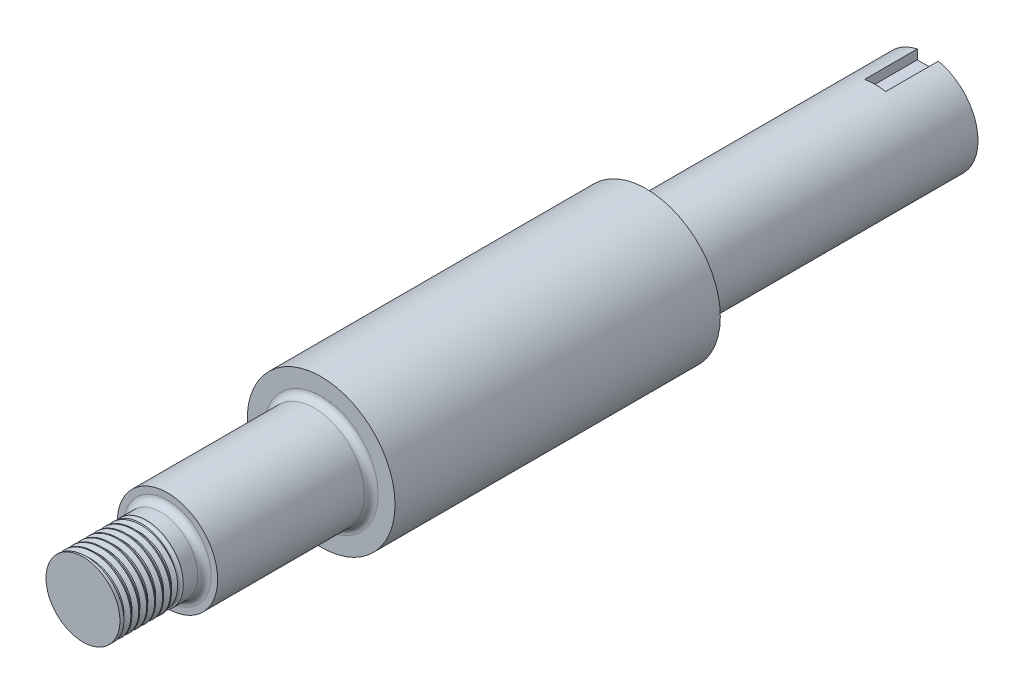
from build123d import *

# Parameters (mm, degrees)
BEARING_REST_FILLET_0_13CM_R = 1.3
CHUCK_THREAD_PITCH           = 1.5
THREAD_SLOT_SKETCH_R         = 0.5
SKETCH_KEY_W                 = 4
SKETCH_KEY_H                 = 2
KEY_CUT_DEPTH                = 10


with BuildPart() as part:
    # Sketch Spindle Skeleton one side → Revolve Spindle (revolve)
    with BuildSketch(Plane(origin=(0, 0, 0), x_dir=(0, 0, -1), z_dir=(1, 0, 0)), mode=Mode.PRIVATE) as revolve_spindle_sk:
        Polygon((-160, 7), (-160, 0), (0, 0), (0, 9.5), (-53.3, 9.5), (-53.3, 14), (-114.9, 14), (-114.9, 9.5), (-144, 9.5), (-144, 7), align=None)
    revolve(revolve_spindle_sk.sketch.rotate(Axis((0, 0, 1000), (0, 0, -1)), 90), axis=Axis((0, 0, 1000), (0, 0, -1)))

    # Bearing Rest Fillet 0.13cm
    bearing_rest_fillet_0_13cm_edges = [part.edges().sort_by_distance(p)[0] for p in [
        (-7, 0, 144),
        (-9.5, 0, 114.9),
        (-9.5, 0, 53.3),
    ]]
    fillet(bearing_rest_fillet_0_13cm_edges, radius=BEARING_REST_FILLET_0_13CM_R)

    # Chuck Thread: the profile of Thread Profile2 profile screwed along a right-hand helix of 6.666667 turns, 8 arcs to a turn; built about Z, then put on its axis
    chuck_thread_z = Axis((0, 0, 0), (0, 0, 1))
    chuck_thread_corners = [(7.0003, 0, -0.000173205), (7.0003, 0, 1.312673201), (6.188101187, 0, 0.843749998), (6.188101187, 0, 0.468749998)]
    with BuildLine(mode=Mode.PRIVATE) as chuck_thread_profile:
        Line(chuck_thread_corners[0], chuck_thread_corners[1])
        Line(chuck_thread_corners[1], chuck_thread_corners[2])
        Line(chuck_thread_corners[2], chuck_thread_corners[3])
        Line(chuck_thread_corners[3], chuck_thread_corners[0])
    chuck_thread_cap = Face(chuck_thread_profile.wire())
    chuck_thread_turn_angles = [0, 22.5, 45, 67.5, 90, 112.5, 135, 157.5, 180, 202.5, 225, 247.5, 270, 292.5, 315, 337.5, 360]
    chuck_thread_turn_weights = [1, 0.9238795325112867, 1, 0.9238795325112867, 1, 0.9238795325112867, 1, 0.9238795325112867, 1, 0.9238795325112867, 1, 0.9238795325112867, 1, 0.9238795325112867, 1, 0.9238795325112867, 1]
    chuck_thread_turn_rails = [Edge.make_bspline([Vector(p[0], p[1], 0).rotate(chuck_thread_z, chuck_thread_turn_angles[k]) / chuck_thread_turn_weights[k] + Vector(0, 0, p[2] + CHUCK_THREAD_PITCH * chuck_thread_turn_angles[k] / 360) for k in range(17)], [0, 0, 0, 1, 1, 2, 2, 3, 3, 4, 4, 5, 5, 6, 6, 7, 7, 8, 8, 8], 2, chuck_thread_turn_weights) for p in chuck_thread_corners]
    chuck_thread_turn_sides = [Face.make_surface_from_curves(chuck_thread_turn_rails[p[0]], chuck_thread_turn_rails[p[1]]) for p in [(0, 1), (1, 2), (2, 3), (3, 0)]]
    chuck_thread_last_angles = [2160, 2182.5, 2205, 2227.5, 2250, 2272.5, 2295, 2317.5, 2340, 2362.5, 2385, 2392.5, 2400]
    chuck_thread_last_weights = [1, 0.9238795325112867, 1, 0.9238795325112867, 1, 0.9238795325112867, 1, 0.9238795325112867, 1, 0.9238795325112867, 1, 0.9914448613738109, 1]
    chuck_thread_last_rails = [Edge.make_bspline([Vector(p[0], p[1], 0).rotate(chuck_thread_z, chuck_thread_last_angles[k]) / chuck_thread_last_weights[k] + Vector(0, 0, p[2] + CHUCK_THREAD_PITCH * chuck_thread_last_angles[k] / 360) for k in range(13)], [0, 0, 0, 1, 1, 2, 2, 3, 3, 4, 4, 5, 5, 6, 6, 6], 2, chuck_thread_last_weights) for p in chuck_thread_corners]
    chuck_thread_last_sides = [Face.make_surface_from_curves(chuck_thread_last_rails[p[0]], chuck_thread_last_rails[p[1]]) for p in [(0, 1), (1, 2), (2, 3), (3, 0)]]
    chuck_thread = Plane(origin=(0, 0, 160), x_dir=(-1, 0, 0), z_dir=(0, 0, -1)) * Solid(Shell([*[p.moved(Location((0, 0, CHUCK_THREAD_PITCH * i))) for i in range(6) for p in chuck_thread_turn_sides], *chuck_thread_last_sides, chuck_thread_cap, chuck_thread_cap.rotate(chuck_thread_z, 2400).moved(Location((0, 0, CHUCK_THREAD_PITCH * 2400 / 360)))]))
    add(chuck_thread, mode=Mode.SUBTRACT)

    # Thread Slot Sketch → Thread Slot (revolve, cut)
    with BuildSketch(Plane(origin=(0, 0, 0), x_dir=(0, 0, -1), z_dir=(1, 0, 0)), mode=Mode.PRIVATE) as thread_slot_sk:
        with Locations((-148.5, 7)):
            Circle(THREAD_SLOT_SKETCH_R)
    revolve(thread_slot_sk.sketch.rotate(Axis((0, 0, 1000), (0, 0, -1)), 270), axis=Axis((0, 0, 1000), (0, 0, -1)), mode=Mode.SUBTRACT)

    # Sketch Key → Key Cut (cut)
    with BuildSketch(Plane(origin=(0, 0, 0), x_dir=(-1, 0, 0), z_dir=(0, 0, -1))):
        with Locations((0, 8.5)):
            Rectangle(SKETCH_KEY_W, SKETCH_KEY_H)
    extrude(amount=-KEY_CUT_DEPTH, mode=Mode.SUBTRACT)


solid = part.part
